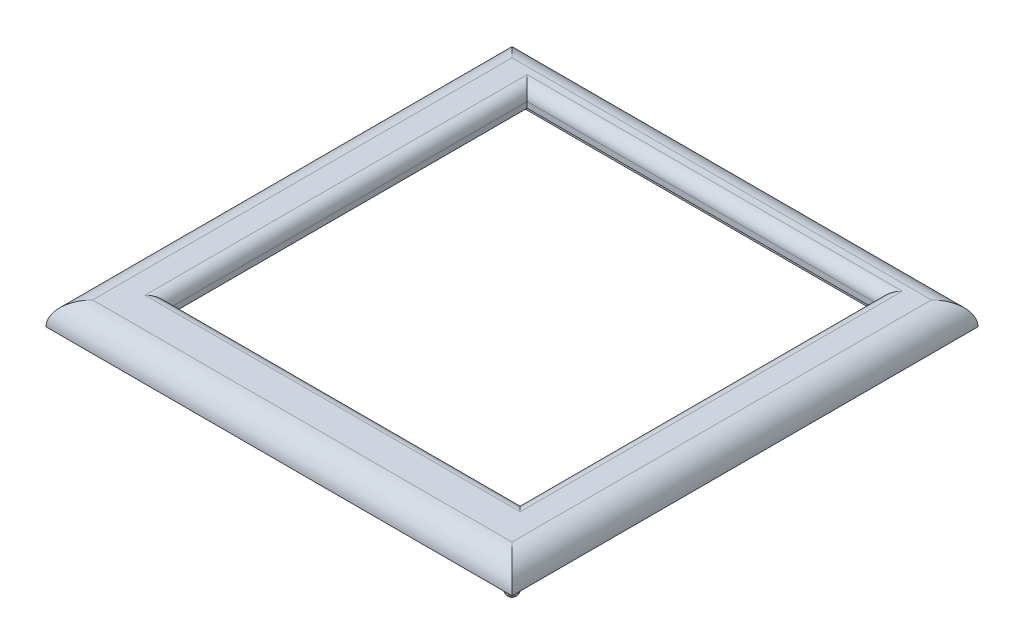
from build123d import *

# Parameters (mm, degrees)
SKETCH_1_W          = 40
SKETCH_1_H          = 40
SKETCH_1_W_2        = 30.2
SKETCH_1_H_2        = 30.8
EXTRUDE_1_DEPTH     = 2
SKETCH_2_W          = 31.6
SKETCH_2_H          = 33.5
CUT_EXTRUDE_1_DEPTH = 0.5
SKETCH_3_W          = 16
SKETCH_3_H          = 1.2
CUT_EXTRUDE_2_DEPTH = 0.5
FILLET_1_R          = 1
FILLET_2_R          = 2
SKETCH_4_R          = 0.5
EXTRUDE_2_DEPTH     = 1
FILLET_4_R          = 0.5
SKETCH_5_R          = 0.5
CUT_EXTRUDE_3_DEPTH = 1
FILLET_5_R          = 0.5
FILLET_6_R          = 0.5


with BuildPart() as part:
    # 草图1 → 凸台-拉伸1 (new body)
    with BuildSketch(Plane(origin=(0, 0, 0), x_dir=(1, 0, 0), z_dir=(0, 1, 0))):
        Rectangle(SKETCH_1_W, SKETCH_1_H)
        with Locations((0, 1)):
            Rectangle(SKETCH_1_W_2, SKETCH_1_H_2, mode=Mode.SUBTRACT)
    extrude(amount=EXTRUDE_1_DEPTH)

    # 草图2 → 切除-拉伸1 (cut)
    with BuildSketch(Plane.XZ):
        Rectangle(SKETCH_2_W, SKETCH_2_H)
    extrude(amount=-CUT_EXTRUDE_1_DEPTH, mode=Mode.SUBTRACT)

    # 草图3 → 切除-拉伸2 (cut)
    with BuildSketch(Plane.XZ.offset(-0.5)):
        with Locations((0, 15)):
            Rectangle(SKETCH_3_W, SKETCH_3_H)
    extrude(amount=-CUT_EXTRUDE_2_DEPTH, mode=Mode.SUBTRACT)

    # 圆角1
    fillet_1_edges = [part.edges().sort_by_distance(p)[0] for p in [
        (15.1, 2, -1),
        (0, 2, -16.4),
        (-15.1, 2, -1),
        (0, 2, 14.4),
    ]]
    fillet(fillet_1_edges, radius=FILLET_1_R - 0.0001)  # a hair under: the kernel refuses the full size

    # 圆角2
    fillet_2_edges = [part.edges().sort_by_distance(p)[0] for p in [
        (0, 2, -20),
        (20, 2, 0),
        (0, 2, 20),
        (-20, 2, 0),
    ]]
    fillet(fillet_2_edges, radius=FILLET_2_R - 0.0001)  # a hair under: the kernel refuses the full size

    # 草图4 → 凸台-拉伸2 (add)
    with BuildSketch(Plane.XZ):
        with Locations(Location((-19, -19, 0), (0, 0, 270))):
            Circle(SKETCH_4_R)
        with Locations(Location((19, 19, 0), (0, 0, 270))):
            Circle(SKETCH_4_R)
    extrude(amount=EXTRUDE_2_DEPTH)

    # 圆角4
    fillet_4_edges = [part.edges().sort_by_distance(p)[0] for p in [
        (19, -1, 19.5),
    ]]
    fillet(fillet_4_edges, radius=FILLET_4_R)

    # 草图5 → 切除-拉伸3 (cut)
    with BuildSketch(Plane.XZ):
        with Locations(Location((19, -19, 0), (0, 0, 270))):
            Circle(SKETCH_5_R)
        with Locations(Location((-19, 19, 0), (0, 0, 270))):
            Circle(SKETCH_5_R)
    extrude(amount=-CUT_EXTRUDE_3_DEPTH, mode=Mode.SUBTRACT)

    # 圆角5
    fillet_5_edges = [part.edges().sort_by_distance(p)[0] for p in [
        (19, 1, -18.5),
        (-19, 1, 19.5),
    ]]
    fillet(fillet_5_edges, radius=FILLET_5_R)

    # 圆角6
    fillet_6_edges = [part.edges().sort_by_distance(p)[0] for p in [
        (-19, -1, -18.5),
    ]]
    fillet(fillet_6_edges, radius=FILLET_6_R)


solid = part.part
